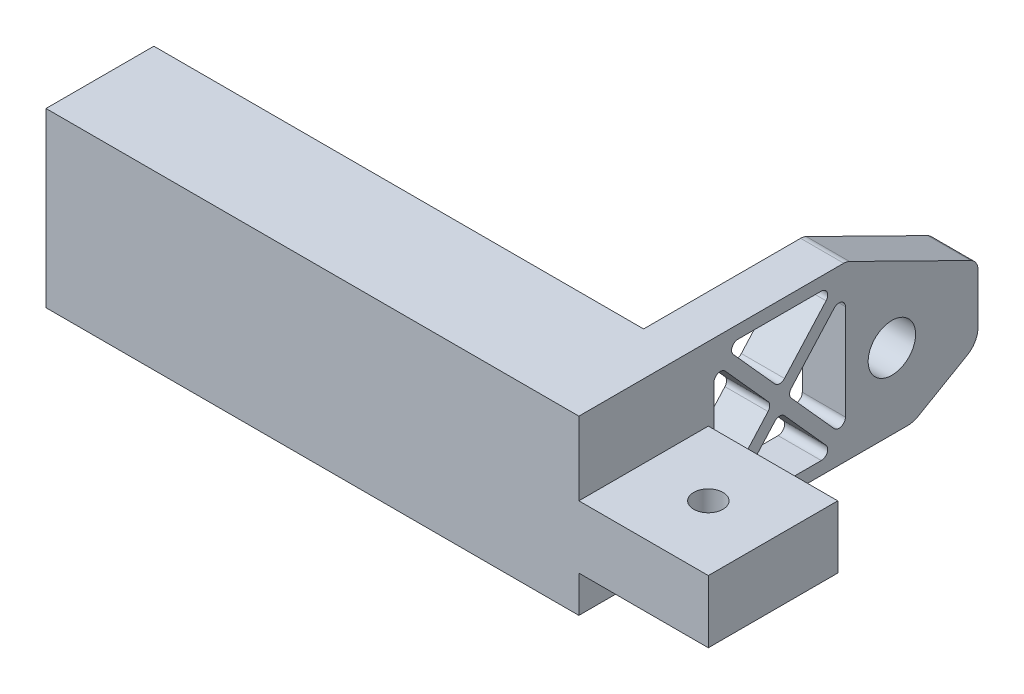
from build123d import *

# Parameters (mm, degrees)
SKETCH1_W             = 92.5
SKETCH1_H             = 40
BOSS_EXTRUDE1_DEPTH   = 10
SKETCH5_R             = 5.5
CUT_EXTRUDE1_DEPTH    = 27
SKETCH6_W             = 30
SKETCH6_H             = 6
BOSS_EXTRUDE5_DEPTH   = 30
SKETCH7_W             = 30
SKETCH7_H             = 30
BOSS_EXTRUDE6_DEPTH   = 8.5
SKETCH4_W             = 25
SKETCH4_H             = 40
SKETCH4_W_2           = 10
SKETCH4_H_2           = 25
BOSS_EXTRUDE7_DEPTH   = 113.5
FILLET1_R             = 3
CHAMFER1_SIZE         = 15
CHAMFER1_SIZE2        = 30.41699103
FILLET3_R             = 3
CHAMFER3_SIZE         = 15
CHAMFER3_SIZE2        = 8.660254038
FILLET7_R             = 5
M8_TAPPED_HOLE1_D     = 6.8
M8_TAPPED_HOLE1_DEPTH = 22.25
M8_TAPPED_HOLE1_TIP   = 2.042926105
CUT_EXTRUDE2_DEPTH    = 138.329360826
FILLET8_R             = 1.5


with BuildPart() as part:
    # Sketch1 → Boss-Extrude1 (new body)
    with BuildSketch(Plane(origin=(0, 0, 0), x_dir=(0, 0, -1), z_dir=(1, 0, 0))):
        with Locations((10.335365854, 0.129573171)):
            Rectangle(SKETCH1_W, SKETCH1_H)
    extrude(amount=BOSS_EXTRUDE1_DEPTH)

    # Sketch5 → Cut-Extrude1 (cut)
    with BuildSketch(Plane.ZY):
        with Locations((-36.625365854, -2.430426829)):
            Circle(SKETCH5_R)
    extrude(amount=-CUT_EXTRUDE1_DEPTH, mode=Mode.SUBTRACT)

    # Sketch6 → Boss-Extrude5 (add)
    with BuildSketch(Plane(origin=(10, 0, 0), x_dir=(0, 0, -1), z_dir=(1, 0, 0))):
        with Locations((-20.914634146, 0.129573171)):
            Rectangle(SKETCH6_W, SKETCH6_H)
    extrude(amount=BOSS_EXTRUDE5_DEPTH)

    # Sketch7 → Boss-Extrude6 (add)
    with BuildSketch(Plane.XZ.offset(2.870426829)):
        with Locations((25, 20.914634146)):
            Rectangle(SKETCH7_W, SKETCH7_H)
    extrude(amount=BOSS_EXTRUDE6_DEPTH)

    # Sketch4 → Boss-Extrude7 (add)
    with BuildSketch(Plane.ZY):
        with Locations((23.414634146, 0.129573171)):
            Rectangle(SKETCH4_W, SKETCH4_H)
        with Locations((23.414634146, 0.129573171)):
            Rectangle(SKETCH4_W_2, SKETCH4_H_2, mode=Mode.SUBTRACT)
    extrude(amount=BOSS_EXTRUDE7_DEPTH)

    # Fillet1
    fillet1_edges = [part.edges().sort_by_distance(p)[0] for p in [
        (-113.5, -12.370426829, 23.414634146),
        (-113.5, 0.129573171, 28.414634146),
        (-113.5, 12.629573171, 23.414634146),
        (-113.5, 0.129573171, 18.414634146),
    ]]
    fillet(fillet1_edges, radius=FILLET1_R)

    # Chamfer1
    chamfer1_edges = [part.edges().sort_by_distance(p)[0] for p in [
        (5, 20.129573171, -56.585365854),
    ]]
    chamfer1_side = [part.faces().sort_by_distance(p)[0] for p in [
        (5, 0.129573171, -56.585365854),
    ]]
    chamfer(chamfer1_edges, length=CHAMFER1_SIZE, length2=CHAMFER1_SIZE2, reference=chamfer1_side[0])

    # Fillet3
    fillet3_edges = [part.edges().sort_by_distance(p)[0] for p in [
        (5, 20.129573171, -26.168374824),
        (5, 5.129573171, -56.585365854),
    ]]
    fillet(fillet3_edges, radius=FILLET3_R)

    # Chamfer3
    chamfer3_edges = [part.edges().sort_by_distance(p)[0] for p in [
        (5, -19.870426829, -56.585365854),
    ]]
    chamfer3_side = [part.faces().sort_by_distance(p)[0] for p in [
        (-41.568936877, -19.870426829, 15.117291954),
    ]]
    chamfer(chamfer3_edges, length=CHAMFER3_SIZE, length2=CHAMFER3_SIZE2, reference=chamfer3_side[0])

    # Fillet7
    fillet7_edges = [part.edges().sort_by_distance(p)[0] for p in [
        (5, -19.870426829, -41.585365854),
        (5, -11.210172791, -56.585365854),
    ]]
    fillet(fillet7_edges, radius=FILLET7_R)

    # M8 Tapped Hole1
    with Locations(Plane(origin=(0, 3.129573171, 0), x_dir=(1, 0, 0), z_dir=(0, 1, 0))):
        with Locations((25, -20.914634146)):
            Hole(M8_TAPPED_HOLE1_D / 2, depth=M8_TAPPED_HOLE1_DEPTH)
            with Locations((0, 0, -(M8_TAPPED_HOLE1_DEPTH + M8_TAPPED_HOLE1_TIP / 2))):  # 118° drill point
                Cone(0, M8_TAPPED_HOLE1_D / 2, M8_TAPPED_HOLE1_TIP, mode=Mode.SUBTRACT)

    # Sketch9 → Cut-Extrude2 (cut, through all)
    with BuildSketch(Plane(origin=(10, 0, 0), x_dir=(0, 0, -1), z_dir=(1, 0, 0))):
        Polygon((25.857505885, 15.129573171), (12.413914695, 0.129573171), (25.857505885, -14.870426829), (25.857505885, 0.129573171), align=None)
        Polygon((10.621435869, 17.129573171), (23.621435869, 17.129573171), (10.621435869, 2.624520373), (-2.378564131, 17.129573171), align=None)
        Polygon((10.621435869, -2.365374032), (-2.378564131, -16.870426829), (10.621435869, -16.870426829), (23.621435869, -16.870426829), align=None)
        Polygon((-4.614634146, -14.870426829), (-4.614634146, 0.129573171), (-4.614634146, 15.129573171), (8.828957044, 0.129573171), align=None)
    extrude(amount=-CUT_EXTRUDE2_DEPTH, mode=Mode.SUBTRACT)

    # Fillet8
    fillet8_edges = [part.edges().sort_by_distance(p)[0] for p in [
        (5, -14.870426829, 4.614634146),
        (5, 15.129573171, 4.614634146),
        (5, 0.129573171, -8.828957044),
        (5, -16.870426829, 2.378564131),
        (5, -16.870426829, -23.621435869),
        (5, -2.365374032, -10.621435869),
        (5, -14.870426829, -25.857505885),
        (5, 0.129573171, -12.413914695),
        (5, 15.129573171, -25.857505885),
        (5, 2.624520373, -10.621435869),
        (5, 17.129573171, -23.621435869),
        (5, 17.129573171, 2.378564131),
    ]]
    fillet(fillet8_edges, radius=FILLET8_R)


solid = part.part
